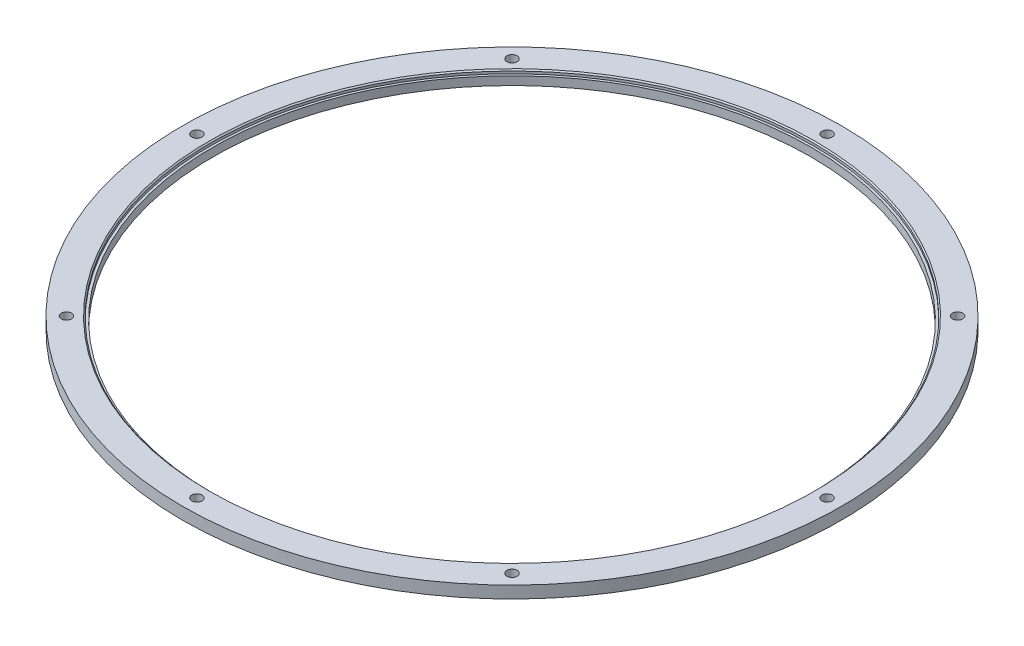
from build123d import *

# Parameters (mm, degrees)
BOSS_EXTRUDE1_OUTLINE_R   = 273
BOSS_EXTRUDE1_OUTLINE_R_2 = 4.25
BOSS_EXTRUDE1_OUTLINE_R_3 = 248
BOSS_EXTRUDE1_DEPTH       = 10
SKETCH2_R                 = 250
CUT_EXTRUDE1_DEPTH        = 3
CHAMFER1_SIZE             = 1


# Read off the part's stored shape, not the designer's step: Boss-Extrude1
with BuildPart() as part:
    # Boss-Extrude1 outline → Boss-Extrude1 (new body)
    with BuildSketch(Plane(origin=(0, 0, 0), x_dir=(1, 0, 0), z_dir=(0, 1, 0))):
        Circle(BOSS_EXTRUDE1_OUTLINE_R)
        with Locations((-184.55486989, -184.55486989)):
            Circle(BOSS_EXTRUDE1_OUTLINE_R_2, mode=Mode.SUBTRACT)
        with Locations((0, -261)):
            Circle(BOSS_EXTRUDE1_OUTLINE_R_2, mode=Mode.SUBTRACT)
        with Locations((184.55486989, -184.55486989)):
            Circle(BOSS_EXTRUDE1_OUTLINE_R_2, mode=Mode.SUBTRACT)
        with Locations((-261, 0)):
            Circle(BOSS_EXTRUDE1_OUTLINE_R_2, mode=Mode.SUBTRACT)
        with Locations((-184.55486989, 184.55486989)):
            Circle(BOSS_EXTRUDE1_OUTLINE_R_2, mode=Mode.SUBTRACT)
        Circle(BOSS_EXTRUDE1_OUTLINE_R_3, mode=Mode.SUBTRACT)
        with Locations((261, 0)):
            Circle(BOSS_EXTRUDE1_OUTLINE_R_2, mode=Mode.SUBTRACT)
        with Locations((0, 261)):
            Circle(BOSS_EXTRUDE1_OUTLINE_R_2, mode=Mode.SUBTRACT)
        with Locations((184.55486989, 184.55486989)):
            Circle(BOSS_EXTRUDE1_OUTLINE_R_2, mode=Mode.SUBTRACT)
    extrude(amount=BOSS_EXTRUDE1_DEPTH)

    # Sketch2 → Cut-Extrude1 (cut)
    with BuildSketch(Plane(origin=(0, 10, 0), x_dir=(1, 0, 0), z_dir=(0, 1, 0))):
        with Locations(Location((0, 0, 0), (0, 0, 270))):
            Circle(SKETCH2_R)
    extrude(amount=-CUT_EXTRUDE1_DEPTH, mode=Mode.SUBTRACT)

    # Chamfer1
    chamfer1_edges = [part.edges().sort_by_distance(p)[0] for p in [
        (0, 10, -250),
    ]]
    chamfer(chamfer1_edges, length=CHAMFER1_SIZE)


solid = part.part
